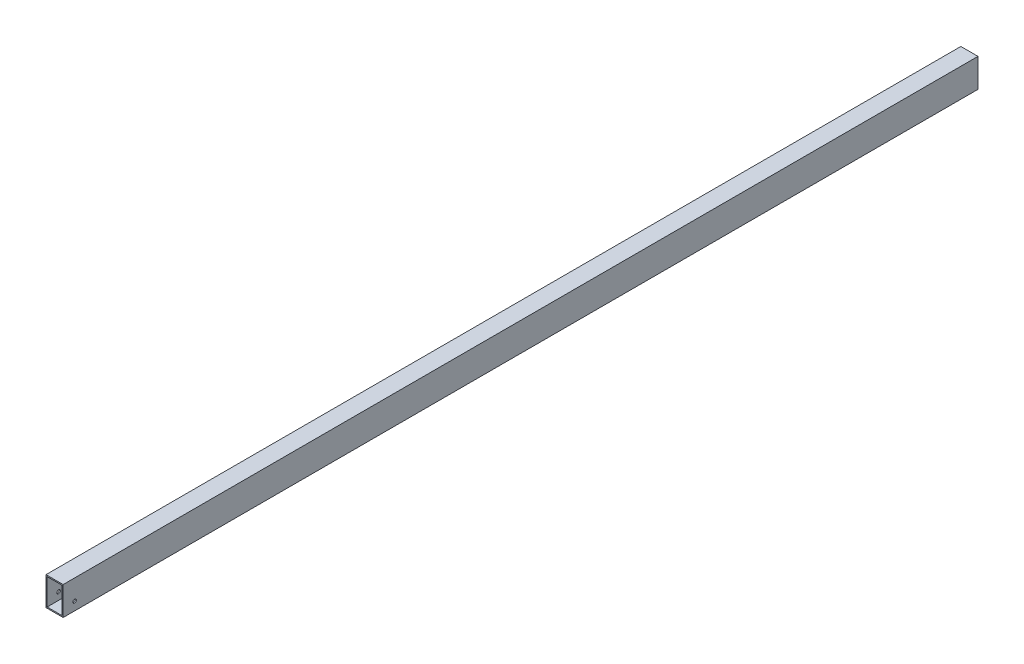
from build123d import *

# Parameters (mm, degrees)
SKETCH_1_W          = 15
SKETCH_1_H          = 25
SKETCH_1_W_2        = 13
SKETCH_1_H_2        = 23
EXTRUDE_1_DEPTH     = 800
SKETCH_4_R          = 1.5
CUT_EXTRUDE_3_DEPTH = 801.531073725


with BuildPart() as part:
    # 草图1 → 拉伸-薄壁1 (new body)
    with BuildSketch(Plane.XY):
        with Locations((7.5, -12.5)):
            Rectangle(SKETCH_1_W, SKETCH_1_H)
        with Locations((7.5, -12.5)):
            Rectangle(SKETCH_1_W_2, SKETCH_1_H_2, mode=Mode.SUBTRACT)
    extrude(amount=EXTRUDE_1_DEPTH)

    # 草图4 → 切除-拉伸3 (cut, through all)
    with BuildSketch(Plane(origin=(15, 0, 0), x_dir=(0, 0, -1), z_dir=(1, 0, 0))):
        with Locations((-790, -17.5)):
            Circle(SKETCH_4_R)
    extrude(amount=-CUT_EXTRUDE_3_DEPTH, mode=Mode.SUBTRACT)


solid = part.part
